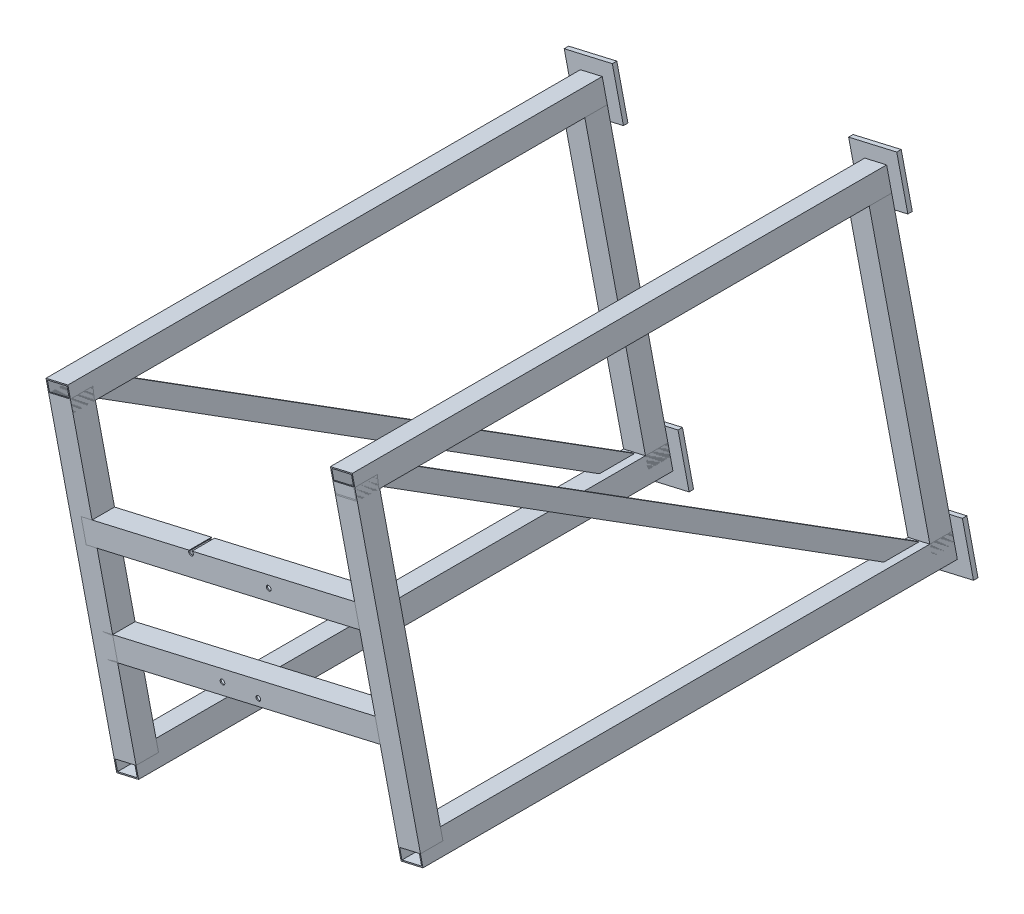
from build123d import *

# Parameters (mm, degrees)
BOSS_EXTRUDE1_START  = -2457.8
BOSS_EXTRUDE1_DEPTH  = 2380
BOSS_EXTRUDE2_START  = -2457.8
BOSS_EXTRUDE2_DEPTH  = 2380
BOSS_EXTRUDE3_START  = -2457.8
BOSS_EXTRUDE3_DEPTH  = 2380
BOSS_EXTRUDE4_START  = -2457.8
BOSS_EXTRUDE4_DEPTH  = 2380
BOSS_EXTRUDE5_START  = -2477.8
BOSS_EXTRUDE5_DEPTH  = 20
BOSS_EXTRUDE6_START  = -2477.8
BOSS_EXTRUDE6_DEPTH  = 20
BOSS_EXTRUDE7_START  = -2477.8
BOSS_EXTRUDE7_DEPTH  = 20
BOSS_EXTRUDE8_START  = -2477.8
BOSS_EXTRUDE8_DEPTH  = 20
BOSS_EXTRUDE9_START  = -177.8
BOSS_EXTRUDE9_DEPTH  = 100
BOSS_EXTRUDE10_START = -172.8
BOSS_EXTRUDE10_DEPTH = 90
BOSS_EXTRUDE11_START = -177.8
BOSS_EXTRUDE11_DEPTH = 100
BOSS_EXTRUDE12_START = -172.8
BOSS_EXTRUDE12_DEPTH = 90
BOSS_EXTRUDE13_START = -2457.8
BOSS_EXTRUDE13_DEPTH = 100
BOSS_EXTRUDE14_START = -2452.8
BOSS_EXTRUDE14_DEPTH = 90
BOSS_EXTRUDE15_START = -2457.8
BOSS_EXTRUDE15_DEPTH = 100
BOSS_EXTRUDE16_START = -2452.8
BOSS_EXTRUDE16_DEPTH = 90
BOSS_EXTRUDE17_START = -177.8
BOSS_EXTRUDE17_DEPTH = 100
BOSS_EXTRUDE18_START = -172.8
BOSS_EXTRUDE18_DEPTH = 90
BOSS_EXTRUDE19_START = -177.8
BOSS_EXTRUDE19_DEPTH = 100
BOSS_EXTRUDE20_START = -172.8
BOSS_EXTRUDE20_DEPTH = 90
BOSS_EXTRUDE21_START = -182.8
SKETCH21_R           = 10.5
BOSS_EXTRUDE21_DEPTH = 110
BOSS_EXTRUDE22_START = -182.8
SKETCH22_R           = 10.5
BOSS_EXTRUDE22_DEPTH = 110
BOSS_EXTRUDE23_START = -182.8
SKETCH23_R           = 10.5
BOSS_EXTRUDE23_DEPTH = 110
BOSS_EXTRUDE24_START = -182.8
SKETCH24_R           = 10.5
BOSS_EXTRUDE24_DEPTH = 110
BOSS_EXTRUDE25_DEPTH = 2538.188330286
BOSS_EXTRUDE26_DEPTH = 2538.188330286


with BuildPart() as part:
    # Sketch1 → Boss-Extrude1 (new body)
    with BuildSketch(Plane.XY.offset(BOSS_EXTRUDE1_START)):
        Polygon((381.351406265, 1762.592671477), (478.788412743, 1785.087776912), (456.293307309, 1882.52478339), (358.85630083, 1860.029677956), align=None)
        Polygon((385.098501317, 1768.589277073), (472.791807148, 1788.834871964), (452.546212257, 1876.528177795), (364.852906426, 1856.282582904), align=None, mode=Mode.SUBTRACT)
    extrude(amount=BOSS_EXTRUDE1_DEPTH)


with BuildPart() as body_2:
    # Sketch2 → Boss-Extrude2 (new body)
    with BuildSketch(Plane.XY.offset(BOSS_EXTRUDE2_START)):
        Polygon((673.787776912, 495.911587257), (771.22478339, 518.406692691), (748.729677956, 615.84369917), (651.292671477, 593.348593735), align=None)
        Polygon((677.534871964, 501.908192852), (765.228177795, 522.153787743), (744.982582904, 609.847093574), (657.289277073, 589.601498683), align=None, mode=Mode.SUBTRACT)
    extrude(amount=BOSS_EXTRUDE2_DEPTH)


with BuildPart() as body_3:
    # Sketch3 → Boss-Extrude3 (new body)
    with BuildSketch(Plane.XY.offset(BOSS_EXTRUDE3_START)):
        Polygon((-885.329677956, 1470.15630083), (-787.892671477, 1492.651406265), (-810.387776912, 1590.088412743), (-907.82478339, 1567.593307309), align=None)
        Polygon((-881.582582904, 1476.152906426), (-793.889277073, 1496.398501317), (-814.134871964, 1584.091807148), (-901.828177795, 1563.846212257), align=None, mode=Mode.SUBTRACT)
    extrude(amount=BOSS_EXTRUDE3_DEPTH)


with BuildPart() as body_4:
    # Sketch4 → Boss-Extrude4 (new body)
    with BuildSketch(Plane.XY.offset(BOSS_EXTRUDE4_START)):
        Polygon((-592.893307309, 203.47521661), (-495.45630083, 225.970322044), (-517.951406265, 323.407328523), (-615.388412743, 300.912223088), align=None)
        Polygon((-589.146212257, 209.471822205), (-501.452906426, 229.717417096), (-521.698501317, 317.410722927), (-609.391807148, 297.165128036), align=None, mode=Mode.SUBTRACT)
    extrude(amount=BOSS_EXTRUDE4_DEPTH)


with BuildPart() as body_5:
    # Sketch5 → Boss-Extrude5 (new body)
    with BuildSketch(Plane.XY.offset(BOSS_EXTRUDE5_START)):
        Polygon((336.386265638, 1690.63340433), (550.747679891, 1740.122636285), (501.258447935, 1954.484050538), (286.897033683, 1904.994818582), align=None)
    extrude(amount=BOSS_EXTRUDE5_DEPTH)


with BuildPart() as body_6:
    # Sketch6 → Boss-Extrude6 (new body)
    with BuildSketch(Plane.XY.offset(BOSS_EXTRUDE6_START)):
        Polygon((628.822636285, 423.952320109), (843.184050538, 473.441552065), (793.694818582, 687.802966317), (579.33340433, 638.313734362), align=None)
    extrude(amount=BOSS_EXTRUDE6_DEPTH)


with BuildPart() as body_7:
    # Sketch7 → Boss-Extrude7 (new body)
    with BuildSketch(Plane.XY.offset(BOSS_EXTRUDE7_START)):
        Polygon((-930.294818582, 1398.197033683), (-715.93340433, 1447.686265638), (-765.422636285, 1662.047679891), (-979.784050538, 1612.558447935), align=None)
    extrude(amount=BOSS_EXTRUDE7_DEPTH)


with BuildPart() as body_8:
    # Sketch8 → Boss-Extrude8 (new body)
    with BuildSketch(Plane.XY.offset(BOSS_EXTRUDE8_START)):
        Polygon((-637.858447935, 131.515949462), (-423.497033683, 181.005181418), (-472.986265638, 395.36659567), (-687.347679891, 345.877363715), align=None)
    extrude(amount=BOSS_EXTRUDE8_DEPTH)


with BuildPart() as body_9:
    # Sketch9 → Boss-Extrude9 (new body)
    with BuildSketch(Plane.XY.offset(BOSS_EXTRUDE9_START)):
        Polygon((662.540224195, 544.630090496), (759.977230673, 567.12519593), (467.540860026, 1833.806280151), (370.103853548, 1811.311174717), align=None)
    extrude(amount=BOSS_EXTRUDE9_DEPTH)


with BuildPart() as body_10:
    # Sketch10 → Boss-Extrude10 (new body)
    with BuildSketch(Plane.XY.offset(BOSS_EXTRUDE10_START)):
        Polygon((667.412074519, 545.754845768), (755.105380349, 566.000440659), (462.669009702, 1832.681524879), (374.975703872, 1812.435929988), align=None)
    extrude(amount=BOSS_EXTRUDE10_DEPTH)


with BuildPart() as body_9_1:
    add(body_9.part)

    # Combine1: cut body 10
    add(body_10.part, mode=Mode.SUBTRACT)


with BuildPart() as body_10_2:
    # Sketch11 → Boss-Extrude11 (new body)
    with BuildSketch(Plane.XY.offset(BOSS_EXTRUDE11_START)):
        Polygon((-604.140860026, 252.193719849), (-506.703853548, 274.688825283), (-799.140224195, 1541.369909504), (-896.577230673, 1518.87480407), align=None)
    extrude(amount=BOSS_EXTRUDE11_DEPTH)


with BuildPart() as body_11:
    # Sketch12 → Boss-Extrude12 (new body)
    with BuildSketch(Plane.XY.offset(BOSS_EXTRUDE12_START)):
        Polygon((-599.269009702, 253.318475121), (-511.575703872, 273.564070012), (-804.012074519, 1540.245154232), (-891.705380349, 1519.999559341), align=None)
    extrude(amount=BOSS_EXTRUDE12_DEPTH)


with BuildPart() as body_10_2_1:
    add(body_10_2.part)

    # Combine2: cut body 11
    add(body_11.part, mode=Mode.SUBTRACT)


with BuildPart() as body_11_2:
    # Sketch13 → Boss-Extrude13 (new body)
    with BuildSketch(Plane.XY.offset(BOSS_EXTRUDE13_START)):
        Polygon((662.540224195, 544.630090496), (759.977230673, 567.12519593), (467.540860026, 1833.806280151), (370.103853548, 1811.311174717), align=None)
    extrude(amount=BOSS_EXTRUDE13_DEPTH)


with BuildPart() as body_12:
    # Sketch14 → Boss-Extrude14 (new body)
    with BuildSketch(Plane.XY.offset(BOSS_EXTRUDE14_START)):
        Polygon((667.412074519, 545.754845768), (755.105380349, 566.000440659), (462.669009702, 1832.681524879), (374.975703872, 1812.435929988), align=None)
    extrude(amount=BOSS_EXTRUDE14_DEPTH)


with BuildPart() as body_11_2_1:
    add(body_11_2.part)

    # Combine3: cut body 12
    add(body_12.part, mode=Mode.SUBTRACT)


with BuildPart() as body_12_2:
    # Sketch15 → Boss-Extrude15 (new body)
    with BuildSketch(Plane.XY.offset(BOSS_EXTRUDE15_START)):
        Polygon((-604.140860026, 252.193719849), (-506.703853548, 274.688825283), (-799.140224195, 1541.369909504), (-896.577230673, 1518.87480407), align=None)
    extrude(amount=BOSS_EXTRUDE15_DEPTH)


with BuildPart() as body_13:
    # Sketch16 → Boss-Extrude16 (new body)
    with BuildSketch(Plane.XY.offset(BOSS_EXTRUDE16_START)):
        Polygon((-599.269009702, 253.318475121), (-511.575703872, 273.564070012), (-804.012074519, 1540.245154232), (-891.705380349, 1519.999559341), align=None)
    extrude(amount=BOSS_EXTRUDE16_DEPTH)


with BuildPart() as body_12_2_1:
    add(body_12_2.part)

    # Combine4: cut body 13
    add(body_13.part, mode=Mode.SUBTRACT)


with BuildPart() as body_13_2:
    # Sketch17 → Boss-Extrude17 (new body)
    with BuildSketch(Plane.XY.offset(BOSS_EXTRUDE17_START)):
        Polygon((-637.349530779, 618.306850161), (629.331553442, 910.743220808), (606.836448007, 1008.180227286), (-659.844636213, 715.743856639), align=None)
    extrude(amount=BOSS_EXTRUDE17_DEPTH)


with BuildPart() as body_14:
    # Sketch18 → Boss-Extrude18 (new body)
    with BuildSketch(Plane.XY.offset(BOSS_EXTRUDE18_START)):
        Polygon((-638.474286051, 623.178700485), (628.20679817, 915.615071132), (607.961203279, 1003.308376962), (-658.719880942, 710.872006315), align=None)
    extrude(amount=BOSS_EXTRUDE18_DEPTH)


with BuildPart() as body_13_2_1:
    add(body_13_2.part)

    # Combine5: cut body 14
    add(body_14.part, mode=Mode.SUBTRACT)


with BuildPart() as body_14_2:
    # Sketch19 → Boss-Extrude19 (new body)
    with BuildSketch(Plane.XY.offset(BOSS_EXTRUDE19_START)):
        Polygon((-728.837124581, 1014.583155509), (537.84395964, 1307.019526156), (515.348854206, 1404.456532635), (-751.332230015, 1112.020161988), align=None)
    extrude(amount=BOSS_EXTRUDE19_DEPTH)


with BuildPart() as body_15:
    # Sketch20 → Boss-Extrude20 (new body)
    with BuildSketch(Plane.XY.offset(BOSS_EXTRUDE20_START)):
        Polygon((-729.961879852, 1019.455005833), (536.719204369, 1311.89137648), (516.473609478, 1399.584682311), (-750.207474743, 1107.148311664), align=None)
    extrude(amount=BOSS_EXTRUDE20_DEPTH)


with BuildPart() as body_14_2_1:
    add(body_14_2.part)

    # Combine6: cut body 15
    add(body_15.part, mode=Mode.SUBTRACT)


with BuildPart() as body_15_2:
    # Sketch21 → Boss-Extrude21 (new body)
    with BuildSketch(Plane.XY.offset(BOSS_EXTRUDE21_START)):
        with Locations((-121.95006348, 788.611398273)):
            Circle(SKETCH21_R)
    extrude(amount=BOSS_EXTRUDE21_DEPTH)


with BuildPart() as body_13_2_2:
    add(body_13_2_1.part)

    # Combine7: cut body 15 2
    add(body_15_2.part, mode=Mode.SUBTRACT)


with BuildPart() as body_15_3:
    # Sketch22 → Boss-Extrude22 (new body)
    with BuildSketch(Plane.XY.offset(BOSS_EXTRUDE22_START)):
        with Locations((37.803517202, 805.68574919)):
            Circle(SKETCH22_R)
    extrude(amount=BOSS_EXTRUDE22_DEPTH)


with BuildPart() as body_13_2_3:
    add(body_13_2_2.part)

    # Combine8: cut body 15 3
    add(body_15_3.part, mode=Mode.SUBTRACT)


with BuildPart() as body_15_4:
    # Sketch23 → Boss-Extrude23 (new body)
    with BuildSketch(Plane.XY.offset(BOSS_EXTRUDE23_START)):
        with Locations((84.134960504, 1253.587755618)):
            Circle(SKETCH23_R)
    extrude(amount=BOSS_EXTRUDE23_DEPTH)


with BuildPart() as body_14_2_2:
    add(body_14_2_1.part)

    # Combine9: cut body 15 4
    add(body_15_4.part, mode=Mode.SUBTRACT)


with BuildPart() as body_15_5:
    # Sketch24 → Boss-Extrude24 (new body)
    with BuildSketch(Plane.XY.offset(BOSS_EXTRUDE24_START)):
        with Locations((-261.935346056, 1216.693272056)):
            Circle(SKETCH24_R)
    extrude(amount=BOSS_EXTRUDE24_DEPTH)


with BuildPart() as body_14_2_3:
    add(body_14_2_2.part)

    # Combine10: cut body 15 5
    add(body_15_5.part, mode=Mode.SUBTRACT)


with BuildPart() as body_15_6:
    # 3DSketch1 → Boss-Extrude25 (new body)
    with BuildSketch(Plane(origin=(697.684265723, 588.002627727, -2378.287053454), x_dir=(0.33560696642461146, -0.7942391255218068, 0.5065097981062415), z_dir=(-0.11521460687436719, 0.49904929004148274, 0.8588803178975969))):
        Polygon((0, 0), (79.114908229, -11.867236234), (80.894993665, 0), (1.780085435, 11.867236234), align=None)
    extrude(amount=BOSS_EXTRUDE25_DEPTH)


with BuildPart() as body_16:
    # 3DSketch3 → Boss-Extrude26 (new body)
    with BuildSketch(Plane(origin=(-568.996818498, 295.56625708, -2378.287053454), x_dir=(0.3356069664246124, -0.7942391255218055, 0.506509798106243), z_dir=(-0.11521460687437408, 0.49904929004148185, 0.8588803178975966))):
        Polygon((0, 0), (79.114908229, -11.867236234), (80.894993665, 0), (1.780085435, 11.867236234), align=None)
    extrude(amount=BOSS_EXTRUDE26_DEPTH)


solid = Compound([part.part, body_2.part, body_3.part, body_4.part, body_5.part, body_6.part, body_7.part, body_8.part, body_9_1.part, body_10_2_1.part, body_11_2_1.part, body_12_2_1.part, body_13_2_3.part, body_14_2_3.part, body_15_6.part, body_16.part])
